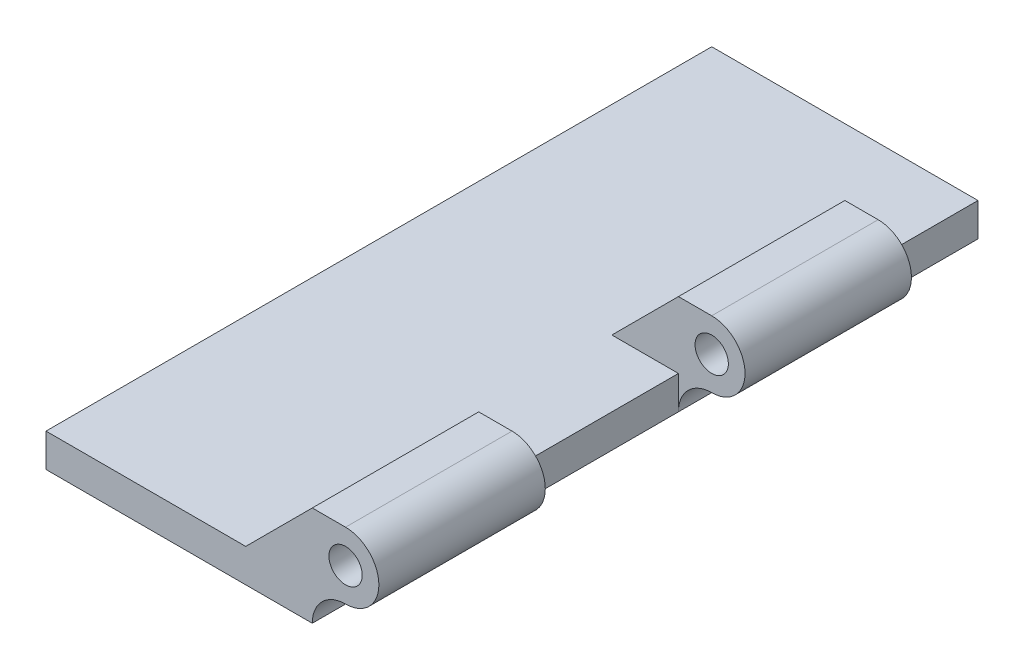
from build123d import *

# Parameters (mm, degrees)
SKETCH1_W              = 8
SKETCH1_H              = 20
BOSS_EXTRUDE1_DEPTH    = 1
SKETCH2_R              = 0.5
BOSS_EXTRUDE2_DEPTH    = 5
FILLET1_R              = 1
LPATTERN1_COUNT        = 2
LPATTERN1_PITCH        = 11
FILLET1_OF_LPATTERN1_R = 1


with BuildPart() as part:
    # Sketch1 → Boss-Extrude1 (new body)
    with BuildSketch(Plane(origin=(0, 0, 0), x_dir=(1, 0, 0), z_dir=(0, 1, 0))):
        with Locations((4, 10)):
            Rectangle(SKETCH1_W, SKETCH1_H)
    extrude(amount=BOSS_EXTRUDE1_DEPTH)

    # Sketch2 → Boss-Extrude2 (add)
    with BuildSketch(Plane.XY):
        with BuildLine():
            Line((8, 1), (9, 1))
            ThreePointArc((9, 1), (10, 2), (9, 3))
            Line((9, 3), (8, 3))
            Line((8, 3), (6, 1))
            Line((6, 1), (8, 1))
        make_face()
        with Locations((9, 2)):
            Circle(SKETCH2_R, mode=Mode.SUBTRACT)
    boss_extrude2 = extrude(amount=-BOSS_EXTRUDE2_DEPTH)

    # Fillet1
    fillet1_edges = [part.edges().sort_by_distance(p)[0] for p in [
        (8, 1, -2.5),
    ]]
    fillet(fillet1_edges, radius=FILLET1_R - 0.0001)  # a hair under: the kernel refuses the full size

    # LPattern1: Boss-Extrude2 ×2
    with Locations(*[(0, 0, -i * LPATTERN1_PITCH) for i in range(1, LPATTERN1_COUNT)]):
        add(boss_extrude2)

    # Fillet1 of LPattern1
    fillet1_of_lpattern1_edges = [part.edges().sort_by_distance(p)[0] for p in [
        (8, 1, -13.5),
    ]]
    fillet(fillet1_of_lpattern1_edges, radius=FILLET1_OF_LPATTERN1_R - 0.0001)  # a hair under: the kernel refuses the full size


solid = part.part
